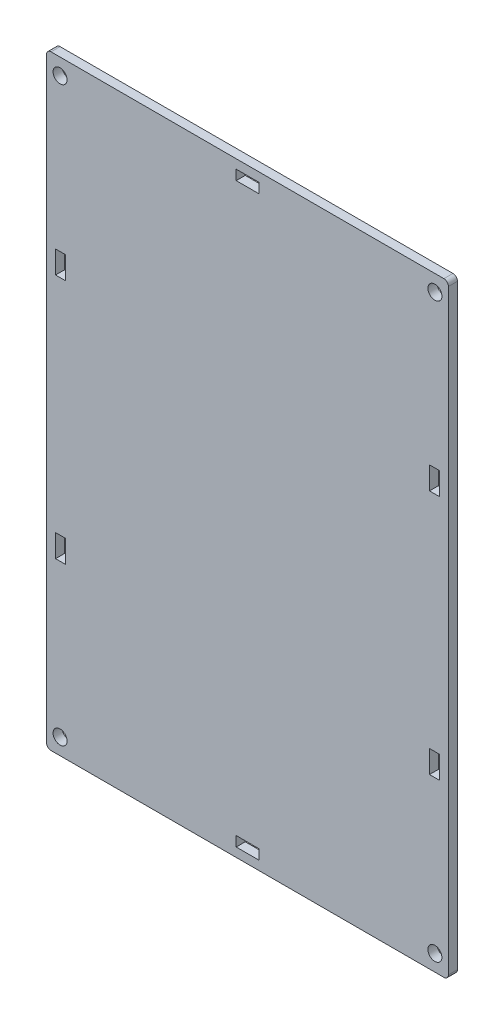
from build123d import *

# Parameters (mm, degrees)
SKETCH1_W           = 89
SKETCH1_H           = 134
SKETCH1_R           = 1.55
SKETCH1_W_2         = 5
SKETCH1_H_2         = 2.2
SKETCH1_W_3         = 2.2
SKETCH1_H_3         = 5
BOSS_EXTRUDE1_DEPTH = 1
FILLET1_R           = 1


with BuildPart() as part:
    # Sketch1 → Boss-Extrude1 (new, symmetric)
    with BuildSketch(Plane.XY):
        Rectangle(SKETCH1_W, SKETCH1_H)
        with Locations((-41.5, 63.4)):
            Circle(SKETCH1_R, mode=Mode.SUBTRACT)
        with Locations((-41.5, -63.4)):
            Circle(SKETCH1_R, mode=Mode.SUBTRACT)
        with Locations((41.5, -63.4)):
            Circle(SKETCH1_R, mode=Mode.SUBTRACT)
        with Locations((41.5, 63.4)):
            Circle(SKETCH1_R, mode=Mode.SUBTRACT)
        with Locations((0, -63.9)):
            Rectangle(SKETCH1_W_2, SKETCH1_H_2, mode=Mode.SUBTRACT)
        with Locations((0, 63.9)):
            Rectangle(SKETCH1_W_2, SKETCH1_H_2, mode=Mode.SUBTRACT)
        with Locations((-41.4, -27.2)):
            Rectangle(SKETCH1_W_3, SKETCH1_H_3, mode=Mode.SUBTRACT)
        with Locations((-41.4, 27.2)):
            Rectangle(SKETCH1_W_3, SKETCH1_H_3, mode=Mode.SUBTRACT)
        with Locations((41.4, -27.2)):
            Rectangle(SKETCH1_W_3, SKETCH1_H_3, mode=Mode.SUBTRACT)
        with Locations((41.4, 27.2)):
            Rectangle(SKETCH1_W_3, SKETCH1_H_3, mode=Mode.SUBTRACT)
    extrude(amount=BOSS_EXTRUDE1_DEPTH, both=True)

    # Fillet1
    fillet1_edges = [part.edges().sort_by_distance(p)[0] for p in [
        (44.5, 67, 0),
        (44.5, -67, 0),
        (-44.5, -67, 0),
        (-44.5, 67, 0),
    ]]
    fillet(fillet1_edges, radius=FILLET1_R)


solid = part.part
